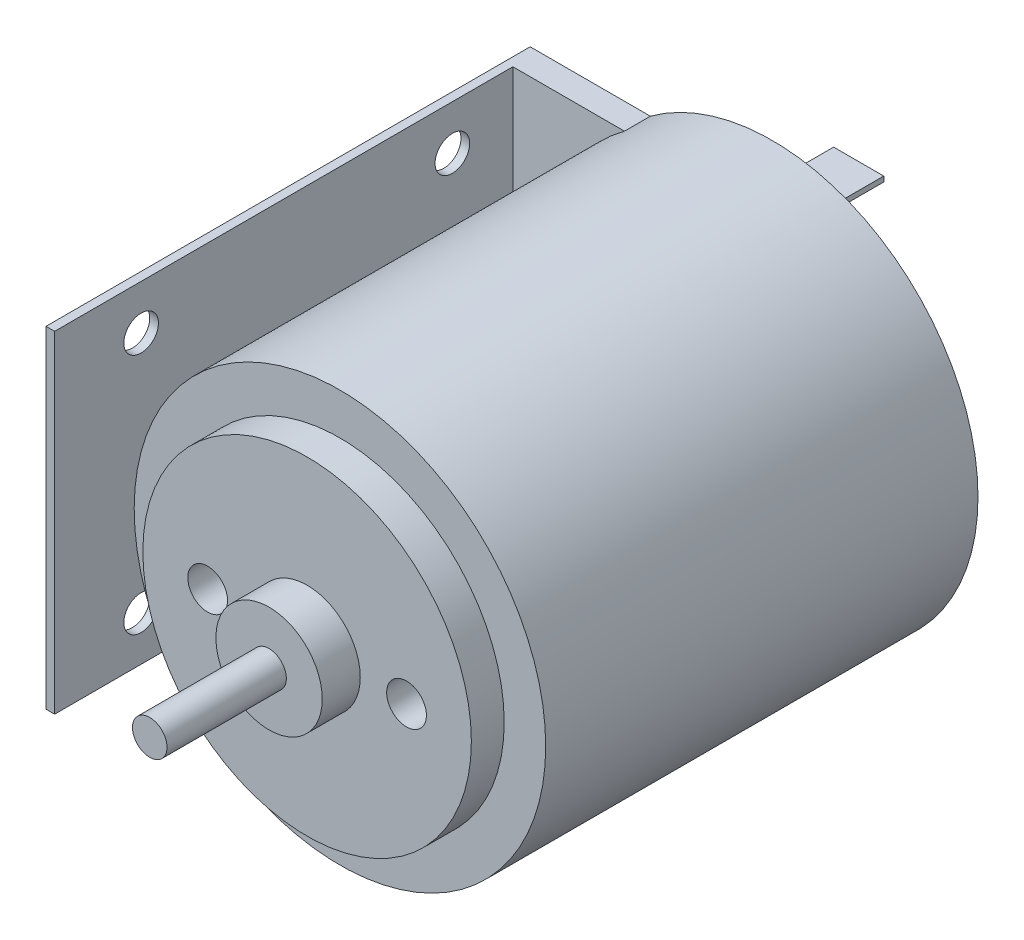
from build123d import *

# Parameters (mm, degrees)
SKETCH_2_R             = 1
EXTRUDE_1_DEPTH        = 36
SKETCH_2_4_R           = 3.075
SKETCH_2_4_R_2         = 1
EXTRUDE_2_DEPTH        = 29.1
EXTRUDE_3_DEPTH        = 26.9
EXTRUDE_3_DEPTH_BACK   = 2
SKETCH_2_5_R           = 4.25
SKETCH_2_5_R_2         = 3.075
SKETCH_2_6_R           = 9.5
SKETCH_2_6_R_2         = 4.25
EXTRUDE_4_DEPTH        = 26.9
SKETCH_2_7_R           = 11.9
SKETCH_2_7_R_2         = 9.5
EXTRUDE_5_DEPTH        = 25
SKETCH_5_W             = 2.9
SKETCH_5_H             = 0.3
EXTRUDE_6_DEPTH        = 5
HOLE_WIZARD_M2_2_D     = 1.6
HOLE_WIZARD_M2_2_DEPTH = 6
HOLE_WIZARD_M2_2_TIP   = 0.480688495
SKETCH_14_R            = 1.15
CUT_EXTRUDE_1_DEPTH    = 3
SKETCH_15_W            = 0.5
SKETCH_15_H            = 19.17801297
EXTRUDE_7_DEPTH        = 28
SKETCH_17_W            = 1.5
SKETCH_17_H            = 19.17801297
EXTRUDE_9_DEPTH        = 10
SKETCH_18_R            = 1
CUT_EXTRUDE_2_DEPTH    = 1


with BuildPart() as part:
    # ｽｹｯﾁ2 → ﾎﾞｽ - 押し出し1 (new body)
    with BuildSketch(Plane.XY):
        Circle(SKETCH_2_R)
    extrude(amount=EXTRUDE_1_DEPTH)

    # ｽｹｯﾁ2<4> → ﾎﾞｽ - 押し出し2 (add)
    with BuildSketch(Plane.XY):
        Circle(SKETCH_2_4_R)
        Circle(SKETCH_2_4_R_2, mode=Mode.SUBTRACT)
    extrude(amount=EXTRUDE_2_DEPTH)

    # ｽｹｯﾁ2<5> → ﾎﾞｽ - 押し出し3 (add, two sides: drawn at the far end of the back side and taken through both)
    with BuildSketch(Plane.XY.offset(-EXTRUDE_3_DEPTH_BACK)):
        Circle(SKETCH_2_5_R)
        Circle(SKETCH_2_5_R_2, mode=Mode.SUBTRACT)
    extrude(amount=EXTRUDE_3_DEPTH + EXTRUDE_3_DEPTH_BACK)

    # ｽｹｯﾁ2<6> → ﾎﾞｽ - 押し出し4 (add)
    with BuildSketch(Plane.XY):
        Circle(SKETCH_2_6_R)
        Circle(SKETCH_2_6_R_2, mode=Mode.SUBTRACT)
    extrude(amount=EXTRUDE_4_DEPTH)

    # ｽｹｯﾁ2<7> → ﾎﾞｽ - 押し出し5 (add)
    with BuildSketch(Plane.XY):
        Circle(SKETCH_2_7_R)
        Circle(SKETCH_2_7_R_2, mode=Mode.SUBTRACT)
    extrude(amount=EXTRUDE_5_DEPTH)

    # ｽｹｯﾁ5 → ﾎﾞｽ - 押し出し6 (add)
    with BuildSketch(Plane(origin=(0, 0, 0), x_dir=(-1, 0, 0), z_dir=(0, 0, -1))):
        with Locations((0, -7.656829655)):
            Rectangle(SKETCH_5_W, SKETCH_5_H)
        with Locations((0, 8.189714354)):
            Rectangle(SKETCH_5_W, SKETCH_5_H)
    extrude(amount=EXTRUDE_6_DEPTH)

    # M2 ねじ穴2
    with Locations(Plane(origin=(0, 0, 0), x_dir=(-1, 0, 0), z_dir=(0, 0, -1))):
        with Locations((-6.45, 0), (6.45, 0)):
            Hole(HOLE_WIZARD_M2_2_D / 2, depth=HOLE_WIZARD_M2_2_DEPTH)
            with Locations((0, 0, -(HOLE_WIZARD_M2_2_DEPTH + HOLE_WIZARD_M2_2_TIP / 2))):  # 118° drill point
                Cone(0, HOLE_WIZARD_M2_2_D / 2, HOLE_WIZARD_M2_2_TIP, mode=Mode.SUBTRACT)

    # ｽｹｯﾁ14 → ｶｯﾄ - 押し出し1 (cut)
    with BuildSketch(Plane.XY.offset(26.9)):
        with Locations((5.75, 0)):
            Circle(SKETCH_14_R)
        with Locations((-5.75, 0)):
            Circle(SKETCH_14_R)
    extrude(amount=-CUT_EXTRUDE_1_DEPTH, mode=Mode.SUBTRACT)



with BuildPart() as body_2:
    # ｽｹｯﾁ15 → ﾎﾞｽ - 押し出し7 (new body)
    with BuildSketch(Plane(origin=(0, 0, 0), x_dir=(-1, 0, 0), z_dir=(0, 0, -1))):
        with Locations((13.75, 0)):
            Rectangle(SKETCH_15_W, SKETCH_15_H)
    extrude(amount=-EXTRUDE_7_DEPTH)


with BuildPart() as part_1:
    add(part.part)

    add(body_2.part)  # ﾎﾞｽ - 押し出し9 merges body 2
    # ｽｹｯﾁ17 → ﾎﾞｽ - 押し出し9 (add)
    with BuildSketch(Plane.ZY.offset(14)):
        with Locations((0.75, 0)):
            Rectangle(SKETCH_17_W, SKETCH_17_H)
    extrude(amount=-EXTRUDE_9_DEPTH)

    # ｽｹｯﾁ18 → ｶｯﾄ - 押し出し2 (cut)
    with BuildSketch(Plane.ZY.offset(14)):
        with Locations((5, 7)):
            Circle(SKETCH_18_R)
        with Locations((5, -7)):
            Circle(SKETCH_18_R)
        with Locations((23, 7)):
            Circle(SKETCH_18_R)
        with Locations((23, -7)):
            Circle(SKETCH_18_R)
    extrude(amount=-CUT_EXTRUDE_2_DEPTH, mode=Mode.SUBTRACT)


solid = part_1.part
